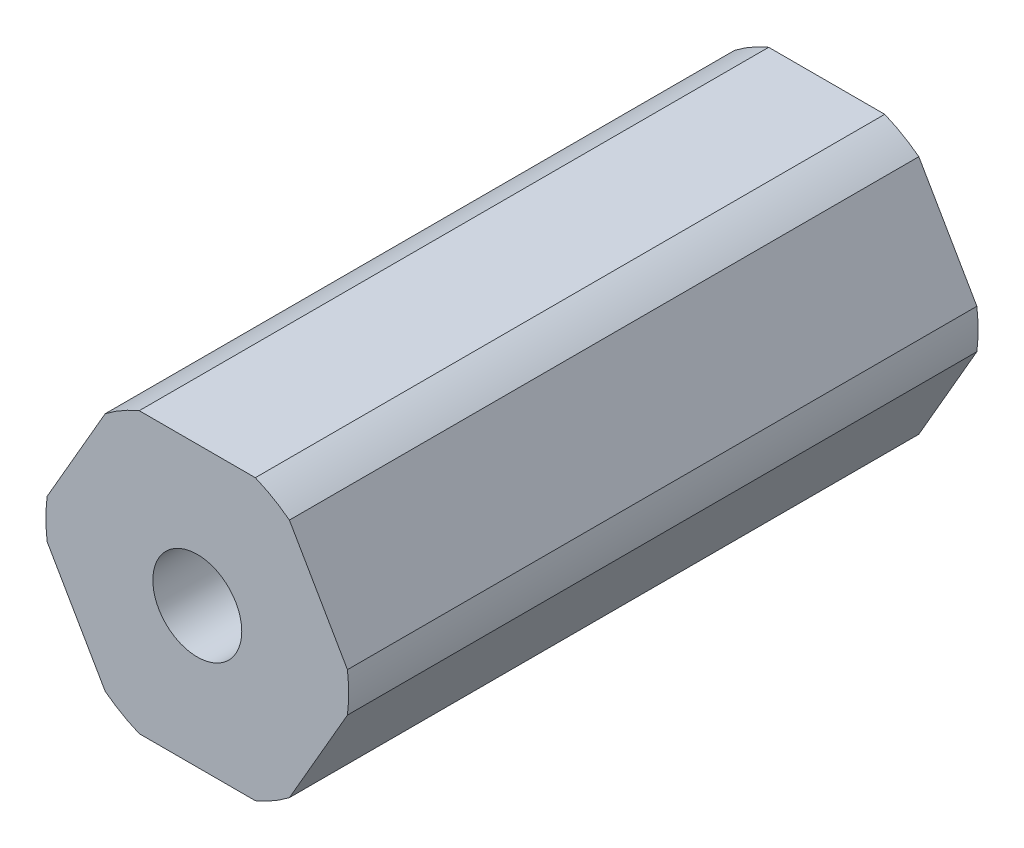
from build123d import *

# Parameters (mm, degrees)
SKETCH1_R                            = 2.0193
BOSS_EXTRUDE1_DEPTH                  = 14.2875
F_10_32_TAPPED_HOLE1_D               = 4.0386
F_10_32_TAPPED_HOLE1_DEPTH           = 11.938
F_10_32_TAPPED_HOLE1_TIP             = 1.213317848
F_10_32_TAPPED_HOLE1_ON_FACE_2_D     = 4.0386
F_10_32_TAPPED_HOLE1_ON_FACE_2_DEPTH = 11.938
F_10_32_TAPPED_HOLE1_ON_FACE_2_TIP   = 1.213317848


with BuildPart() as part:
    # Sketch1 → Boss-Extrude1 (new, symmetric)
    with BuildSketch(Plane.XY):
        with BuildLine():
            ThreePointArc((6.874999966, 0), (6.860422465, 0.447468582), (6.816751782, 0.893039571))
            Line((6.816751782, 0.893039571), (4.181770846, 5.456960429))
            ThreePointArc((4.181770846, 5.456960429), (3.437499983, 5.953924622), (2.634980936, 6.35))
            Line((2.634980936, 6.35), (-2.634980936, 6.35))
            ThreePointArc((-2.634980936, 6.35), (-3.437499983, 5.953924622), (-4.181770846, 5.456960429))
            Line((-4.181770846, 5.456960429), (-6.816751782, 0.893039571))
            ThreePointArc((-6.816751782, 0.893039571), (-6.874999966, 0), (-6.816751782, -0.893039571))
            Line((-6.816751782, -0.893039571), (-4.181770846, -5.456960429))
            ThreePointArc((-4.181770846, -5.456960429), (-3.437499983, -5.953924622), (-2.634980936, -6.35))
            Line((-2.634980936, -6.35), (2.634980936, -6.35))
            ThreePointArc((2.634980936, -6.35), (3.437499983, -5.953924622), (4.181770846, -5.456960429))
            Line((4.181770846, -5.456960429), (6.816751782, -0.893039571))
            ThreePointArc((6.816751782, -0.893039571), (6.860422465, -0.447468582), (6.874999966, 0))
        make_face()
        Circle(SKETCH1_R, mode=Mode.SUBTRACT)
    extrude(amount=BOSS_EXTRUDE1_DEPTH, both=True)

    # #10-32 Tapped Hole1
    with Locations(Plane.XY.offset(14.2875)):
        with Locations((0, 0)):
            Hole(F_10_32_TAPPED_HOLE1_D / 2, depth=F_10_32_TAPPED_HOLE1_DEPTH)
            with Locations((0, 0, -(F_10_32_TAPPED_HOLE1_DEPTH + F_10_32_TAPPED_HOLE1_TIP / 2))):  # 118° drill point
                Cone(0, F_10_32_TAPPED_HOLE1_D / 2, F_10_32_TAPPED_HOLE1_TIP, mode=Mode.SUBTRACT)

    # #10-32 Tapped Hole1 on face 2
    with Locations(Plane.XY.offset(-14.2875)):
        with Locations((0, 0)):
            Hole(F_10_32_TAPPED_HOLE1_ON_FACE_2_D / 2, depth=F_10_32_TAPPED_HOLE1_ON_FACE_2_DEPTH)
            with Locations((0, 0, -(F_10_32_TAPPED_HOLE1_ON_FACE_2_DEPTH + F_10_32_TAPPED_HOLE1_ON_FACE_2_TIP / 2))):  # 118° drill point
                Cone(0, F_10_32_TAPPED_HOLE1_ON_FACE_2_D / 2, F_10_32_TAPPED_HOLE1_ON_FACE_2_TIP, mode=Mode.SUBTRACT)


solid = part.part
